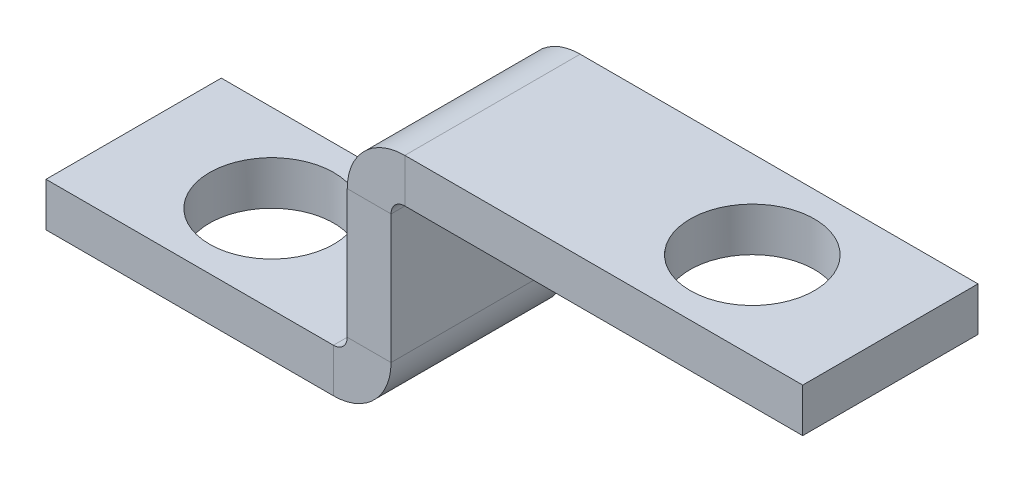
from build123d import *

# Parameters (mm, degrees)
SKETCH1_W                    = 25
SKETCH1_H                    = 12.7
BOSS_EXTRUDE1_DEPTH          = 3.175
EDGE_FLANGE1_STRIP_W         = 14.7
EDGE_FLANGE1_STRIP_H         = 3.175
EDGE_FLANGE1_STRIP_CUT_DEPTH = 12.7
EDGE_FLANGE1_DEPTH           = 12.7
EDGE_FLANGE2_STRIP_W         = 14.7
EDGE_FLANGE2_STRIP_H         = 3.175
EDGE_FLANGE2_STRIP_CUT_DEPTH = 12.7
EDGE_FLANGE2_DEPTH           = 12.7
M8_CLEARANCE_HOLE1_D         = 9


# Sheet-metal steps are written as plain solids
with BuildPart() as part:
    # Sketch1 → Boss-Extrude1 (new body)
    with BuildSketch(Plane(origin=(0, 0, 0), x_dir=(1, 0, 0), z_dir=(0, 1, 0))):
        with Locations((12.5, 6.35)):
            Rectangle(SKETCH1_W, SKETCH1_H)
    extrude(amount=BOSS_EXTRUDE1_DEPTH)

    # Edge-Flange1 strip (across the edge) → Edge-Flange1 strip cut (cut)
    with BuildSketch(Plane(origin=(25, 3.175, 0), x_dir=(-1, 0, 0), z_dir=(0, 0, -1))):
        with Locations((-3.175, -1.5875)):
            Rectangle(EDGE_FLANGE1_STRIP_W, EDGE_FLANGE1_STRIP_H)
    extrude(amount=EDGE_FLANGE1_STRIP_CUT_DEPTH, mode=Mode.SUBTRACT)

    # Edge-Flange1 section (across the edge) → Edge-Flange1 (add)
    with BuildSketch(Plane(origin=(25, 3.175, 0), x_dir=(-1, 0, 0), z_dir=(0, 0, -1))):
        with BuildLine():
            Line((0, 1), (0, 11.325))
            Line((0, 11.325), (3.175, 11.325))
            Line((3.175, 11.325), (3.175, 1))
            ThreePointArc((3.175, 1), (3.467893219, 0.292893219), (4.175, 0))
            Line((4.175, 0), (4.175, -3.175))
            ThreePointArc((4.175, -3.175), (1.222829189, -1.952170811), (0, 1))
        make_face()
    extrude(amount=EDGE_FLANGE1_DEPTH)

    # Edge-Flange2 strip (across the edge) → Edge-Flange2 strip cut (cut)
    with BuildSketch(Plane(origin=(25, 14.5, -12.7), x_dir=(0, -1, 0), z_dir=(0, 0, 1))):
        with Locations((-6.35, -1.5875)):
            Rectangle(EDGE_FLANGE2_STRIP_W, EDGE_FLANGE2_STRIP_H)
    extrude(amount=EDGE_FLANGE2_STRIP_CUT_DEPTH, mode=Mode.SUBTRACT)

    # Edge-Flange2 section (across the edge) → Edge-Flange2 (add)
    with BuildSketch(Plane(origin=(25, 14.5, -12.7), x_dir=(0, -1, 0), z_dir=(0, 0, 1))):
        with BuildLine():
            Line((-3.175, 1), (-3.175, 29.825))
            Line((-3.175, 29.825), (0, 29.825))
            Line((0, 29.825), (0, 1))
            ThreePointArc((0, 1), (0.292893219, 0.292893219), (1, 0))
            Line((1, 0), (1, -3.175))
            ThreePointArc((1, -3.175), (-1.952170811, -1.952170811), (-3.175, 1))
        make_face()
    extrude(amount=EDGE_FLANGE2_DEPTH)

    # M8 Clearance Hole1 (through all)
    with Locations(Plane(origin=(0, 17.675, 0), x_dir=(1, 0, 0), z_dir=(0, 1, 0))):
        with Locations((44.825, 6.35), (10, 6.35)):
            Hole(M8_CLEARANCE_HOLE1_D / 2)


solid = part.part
